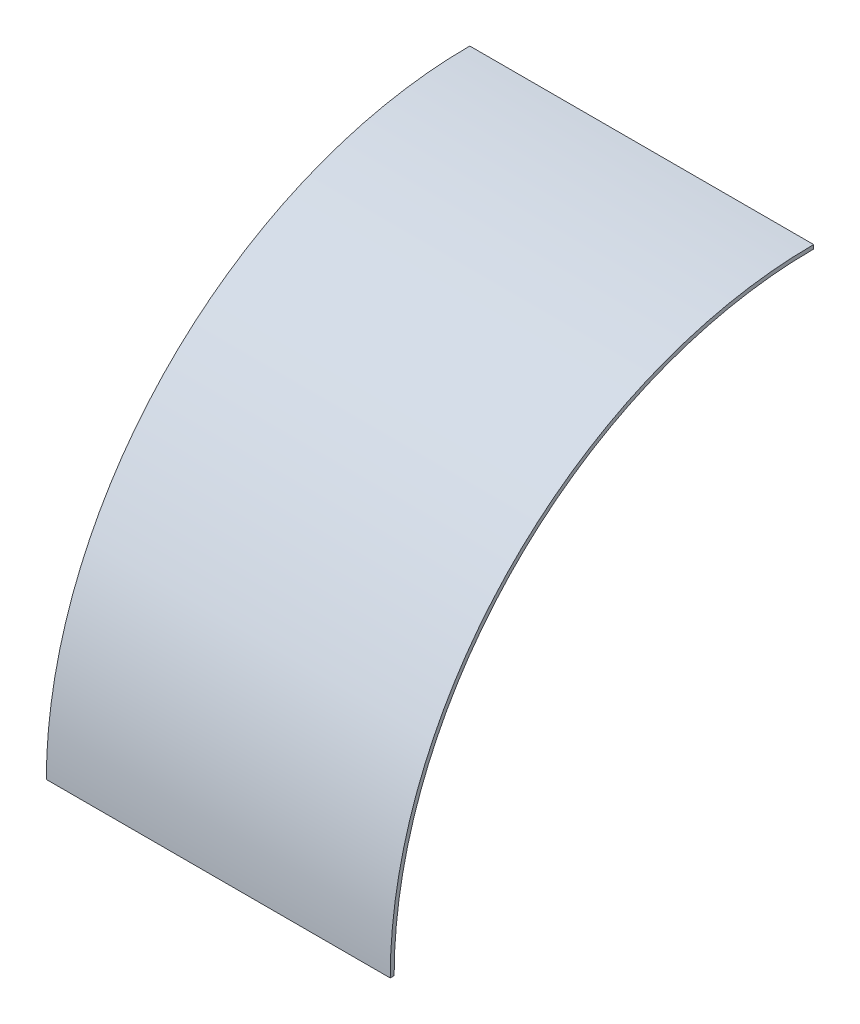
from build123d import *

# Parameters (mm, degrees)
EXTRUDE_THIN1_DEPTH = 139.7


with BuildPart() as part:
    # Sketch1 → Extrude-Thin1 (new body)
    with BuildSketch(Plane(origin=(0, 0, 0), x_dir=(0, 0, -1), z_dir=(1, 0, 0))):
        with BuildLine():
            ThreePointArc((0, 170.434), (-120.515037145, 120.515037145), (-170.434, 0))
            Line((-170.434, 0), (-172.0215, 0))
            ThreePointArc((-172.0215, 0), (-121.63756916, 121.63756916), (0, 172.0215))
            Line((0, 172.0215), (0, 170.434))
        make_face()
    extrude(amount=EXTRUDE_THIN1_DEPTH)


solid = part.part
